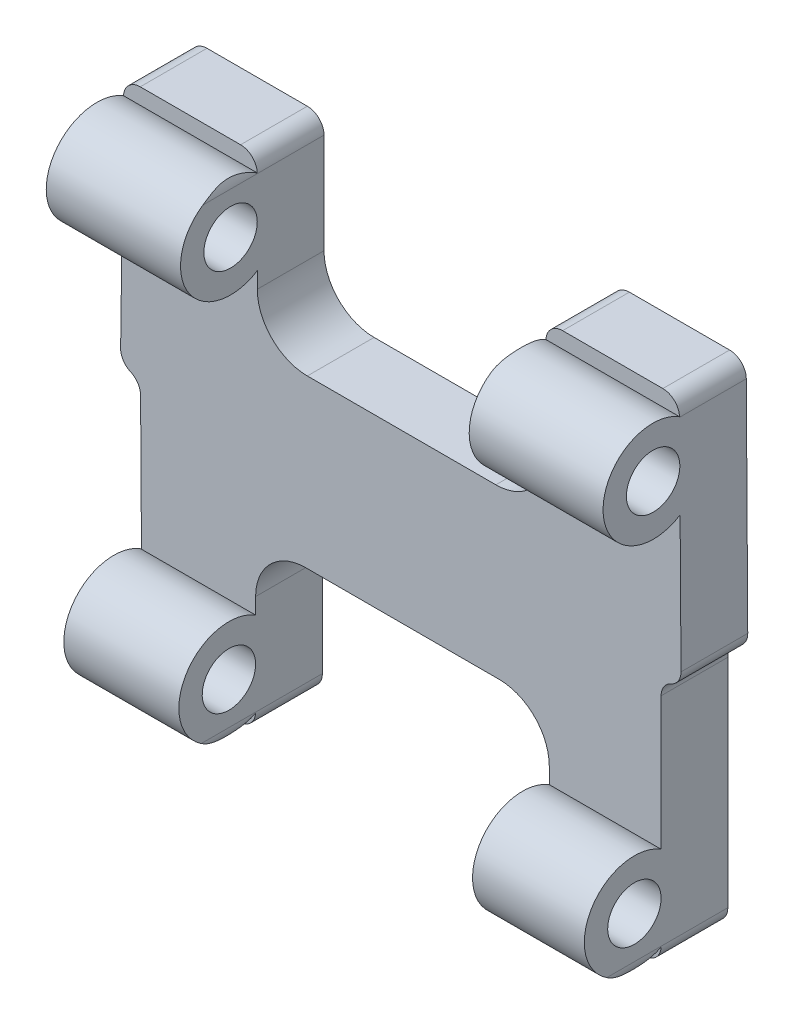
from build123d import *

# Parameters (mm, degrees)
BOSS_EXTRUDE1_DEPTH             = 4
FILLET1_R                       = 1
BOSS_EXTRUDE3_REACH             = 25.017
SKETCH5_R                       = 3
SKETCH5_R_2                     = 1.6
BOSS_EXTRUDE3_DIRECTION_2_REACH = 25.017
CUT_EXTRUDE2_START              = -8.6000001
CUT_EXTRUDE2_DEPTH              = 6.0000001


# Read off the part's stored shape, not the designer's step: Cut-Extrude2
with BuildPart() as part:
    # Sketch1 → Boss-Extrude1 (new body)
    with BuildSketch(Plane.XY):
        with BuildLine():
            Line((-25.399999997, 14.999666663), (-25.399999997, 7.999666663))
            ThreePointArc((-25.399999997, 7.999666663), (-24.52132034, 5.878346319), (-22.399999997, 4.999666663))
            Line((-22.399999997, 4.999666663), (-11.099999997, 4.999666663))
            ThreePointArc((-11.099999997, 4.999666663), (-8.978679653, 5.878346319), (-8.099999997, 7.999666663))
            Line((-8.099999997, 7.999666663), (-8.099999997, 14.999666663))
            Line((-8.099999997, 14.999666663), (-0.099999997, 14.999666663))
            Line((-0.099999997, 14.999666663), (0, 0))
            Line((0, 0), (-0.2, 0))
            ThreePointArc((-0.2, 0), (-0.907106781, -0.292893219), (-1.2, -1))
            Line((-1.2, -1), (-1.2, -14.999666663))
            Line((-1.2, -14.999666663), (-7.900000003, -14.999666663))
            Line((-7.900000003, -14.999666663), (-7.900000003, -7.999666663))
            ThreePointArc((-7.900000003, -7.999666663), (-8.77867966, -5.878346319), (-10.900000003, -4.999666663))
            Line((-10.900000003, -4.999666663), (-22.500000003, -4.999666663))
            ThreePointArc((-22.500000003, -4.999666663), (-24.621320347, -5.878346319), (-25.500000003, -7.999666663))
            Line((-25.500000003, -7.999666663), (-25.500000003, -14.999666663))
            Line((-25.500000003, -14.999666663), (-32.300000003, -14.999666663))
            Line((-32.300000003, -14.999666663), (-32.39337598, -0.993276115))
            ThreePointArc((-32.39337598, -0.993276115), (-32.688706434, -0.290384923), (-33.39363154, 5.7325e-05))
            Line((-33.39363154, 5.7325e-05), (-33.6, 0))
            Line((-33.6, 0), (-33.399999997, 14.999666663))
            Line((-33.399999997, 14.999666663), (-25.399999997, 14.999666663))
        make_face()
    extrude(amount=BOSS_EXTRUDE1_DEPTH)

    # Fillet1
    fillet1_edges = [part.edges().sort_by_distance(p)[0] for p in [
        (-7.900000003, -14.999666663, 2),
        (-25.500000003, -14.999666663, 2),
        (-0.099999997, 14.999666663, 2),
        (-8.099999997, 14.999666663, 2),
        (-25.399999997, 14.999666663, 2),
        (-33.399999997, 14.999666663, 2),
        (-32.300000003, -14.999666663, 2),
        (-33.6, 0, 2),
        (-1.2, -14.999666663, 2),
        (0, 0, 2),
    ]]
    fillet(fillet1_edges, radius=FILLET1_R)

    # Boss-Extrude3: up to this plane
    boss_extrude3_end = Plane(origin=(-33.399999997, 14.999666663, 4), z_dir=(0.9999111190085467, -0.013332444752411323, 0))
    # Sketch5 → Boss-Extrude3 (add, up to the surface)
    with BuildSketch(Plane.ZY.offset(16.999999997), mode=Mode.PRIVATE) as boss_extrude3_sk1:
        with Locations(Location((5.6, 11.499666663, 0), (0, 0, 123.557309762))):
            Circle(SKETCH5_R)
        with Locations(Location((5.6, 11.499666663, 0), (0, 0, 90))):
            Circle(SKETCH5_R_2, mode=Mode.SUBTRACT)
    boss_extrude3_tool1 = split(extrude(boss_extrude3_sk1.sketch, amount=BOSS_EXTRUDE3_REACH, mode=Mode.PRIVATE), bisect_by=boss_extrude3_end, keep=Keep.BOTH, mode=Mode.PRIVATE)
    add(boss_extrude3_tool1.solids().sort_by_distance((-17, 9.070377, 7.211408))[0])
    # Sketch5 → Boss-Extrude3 (add, up to the surface)
    with BuildSketch(Plane.ZY.offset(16.999999997), mode=Mode.PRIVATE) as boss_extrude3_sk2:
        with Locations(Location((5.6, -11.499666663, 0), (0, 0, 90))):
            Circle(SKETCH5_R)
        with Locations(Location((5.6, -11.499666663, 0), (0, 0, 90))):
            Circle(SKETCH5_R_2, mode=Mode.SUBTRACT)
    boss_extrude3_tool2 = split(extrude(boss_extrude3_sk2.sketch, amount=BOSS_EXTRUDE3_REACH, mode=Mode.PRIVATE), bisect_by=boss_extrude3_end, keep=Keep.BOTH, mode=Mode.PRIVATE)
    add(boss_extrude3_tool2.solids().sort_by_distance((-17, -14.414814, 5.6))[0])

    # Boss-Extrude3 direction 2: up to this plane
    boss_extrude3_direction_2_end = Plane(origin=(-0.099999997, 14.999666663, 4), z_dir=(-0.9999777775323199, -0.006666666447507326, 0))
    # Sketch5 → Boss-Extrude3 direction 2 (add, up to the surface)
    with BuildSketch(Plane.ZY.offset(16.999999997), mode=Mode.PRIVATE) as boss_extrude3_direction_2_sk1:
        with Locations(Location((5.6, 11.499666663, 0), (0, 0, 123.557309762))):
            Circle(SKETCH5_R)
        with Locations(Location((5.6, 11.499666663, 0), (0, 0, 90))):
            Circle(SKETCH5_R_2, mode=Mode.SUBTRACT)
    boss_extrude3_direction_2_tool1 = split(extrude(boss_extrude3_direction_2_sk1.sketch, amount=-BOSS_EXTRUDE3_DIRECTION_2_REACH, mode=Mode.PRIVATE), bisect_by=boss_extrude3_direction_2_end, keep=Keep.BOTH, mode=Mode.PRIVATE)
    add(boss_extrude3_direction_2_tool1.solids().sort_by_distance((-17, 9.070377, 7.211408))[0])
    # Sketch5 → Boss-Extrude3 direction 2 (add, up to the surface)
    with BuildSketch(Plane.ZY.offset(16.999999997), mode=Mode.PRIVATE) as boss_extrude3_direction_2_sk2:
        with Locations(Location((5.6, -11.499666663, 0), (0, 0, 90))):
            Circle(SKETCH5_R)
        with Locations(Location((5.6, -11.499666663, 0), (0, 0, 90))):
            Circle(SKETCH5_R_2, mode=Mode.SUBTRACT)
    boss_extrude3_direction_2_tool2 = split(extrude(boss_extrude3_direction_2_sk2.sketch, amount=-BOSS_EXTRUDE3_DIRECTION_2_REACH, mode=Mode.PRIVATE), bisect_by=boss_extrude3_direction_2_end, keep=Keep.BOTH, mode=Mode.PRIVATE)
    add(boss_extrude3_direction_2_tool2.solids().sort_by_distance((-17, -14.414814, 5.6))[0])

    # Cut-Extrude2 outline → Cut-Extrude2 (cut)
    with BuildSketch(Plane(origin=(0, 0, 0), x_dir=(-1, 0, 0), z_dir=(0, 0, -1)).offset(CUT_EXTRUDE2_START)):
        Polygon((37.39337598, -0.993276115), (32.39337598, -0.993276115), (32.39337598, -8.499666663), (32.39337598, -14.499666663), (32.39337598, -14.999666663), (37.39337598, -14.999666663), align=None)
        with BuildLine():
            Line((26.399999997, 14.999666663), (7.099999997, 14.999666663))
            ThreePointArc((7.099999997, 14.999666663), (7.807106778, 14.706773444), (8.099999997, 13.999666663))
            Line((8.099999997, 13.999666663), (8.099999997, 7.999666663))
            ThreePointArc((8.099999997, 7.999666663), (8.978679653, 5.878346319), (11.099999997, 4.999666663))
            Line((11.099999997, 4.999666663), (22.399999997, 4.999666663))
            ThreePointArc((22.399999997, 4.999666663), (24.52132034, 5.878346319), (25.399999997, 7.999666663))
            Line((25.399999997, 7.999666663), (25.399999997, 13.999666663))
            ThreePointArc((25.399999997, 13.999666663), (25.692893216, 14.706773444), (26.399999997, 14.999666663))
        make_face()
        with BuildLine():
            Line((1.2, -13.999666663), (1.2, -1))
            Line((1.2, -1), (-2.8, -1))
            Line((-2.8, -1), (-2.8, -14.999666663))
            Line((-2.8, -14.999666663), (2.2, -14.999666663))
            ThreePointArc((2.2, -14.999666663), (1.492893219, -14.706773444), (1.2, -13.999666663))
        make_face()
        with BuildLine():
            ThreePointArc((7.900000003, -13.999666663), (7.607106784, -14.706773444), (6.900000003, -14.999666663))
            Line((6.900000003, -14.999666663), (26.500000003, -14.999666663))
            ThreePointArc((26.500000003, -14.999666663), (25.792893222, -14.706773444), (25.500000003, -13.999666663))
            Line((25.500000003, -13.999666663), (25.500000003, -7.999666663))
            ThreePointArc((25.500000003, -7.999666663), (24.621320347, -5.878346319), (22.500000003, -4.999666663))
            Line((22.500000003, -4.999666663), (10.900000003, -4.999666663))
            ThreePointArc((10.900000003, -4.999666663), (8.77867966, -5.878346319), (7.900000003, -7.999666663))
            Line((7.900000003, -7.999666663), (7.900000003, -13.999666663))
        make_face()
    extrude(amount=CUT_EXTRUDE2_DEPTH, mode=Mode.SUBTRACT)


solid = part.part
